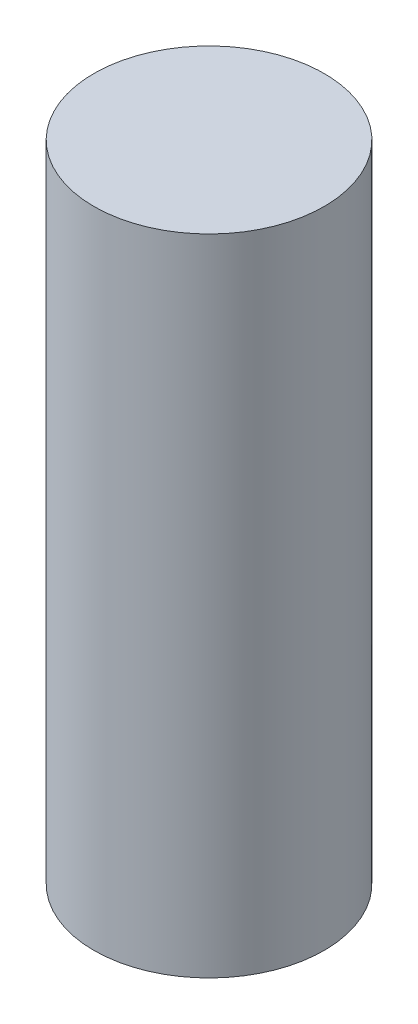
from build123d import *

# Parameters (mm, degrees)
SKETCH1_R           = 7.15
BOSS_EXTRUDE1_DEPTH = 40


with BuildPart() as part:
    # Sketch1 → Boss-Extrude1 (new body)
    with BuildSketch(Plane(origin=(0, 0, 0), x_dir=(1, 0, 0), z_dir=(0, 1, 0))):
        Circle(SKETCH1_R)
    extrude(amount=BOSS_EXTRUDE1_DEPTH)


solid = part.part
